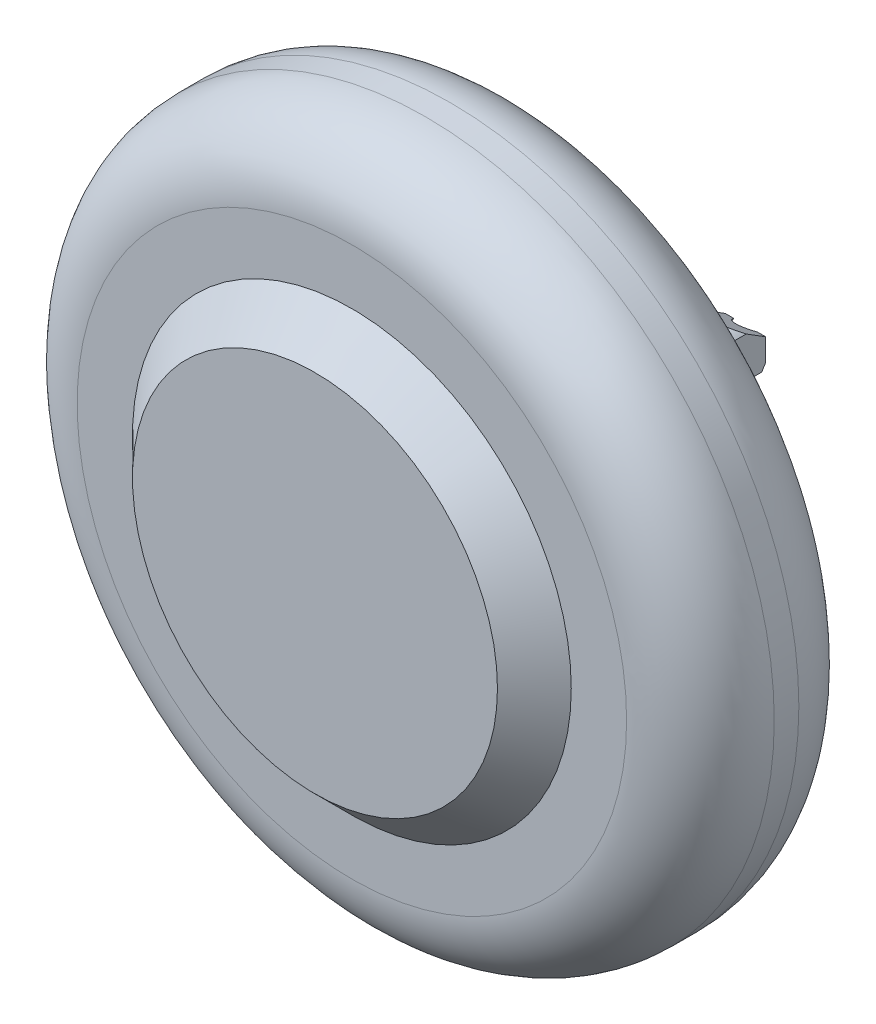
from build123d import *

# Parameters (mm, degrees)
SKETCH_1_R           = 85
EXTRUDE_1_DEPTH      = 21
SKETCH_2_R           = 54.5
EXTRUDE_2_DEPTH      = 30
CHAMFER_1_SIZE       = 10
SKETCH_3_R           = 7
EXTRUDE_3_DEPTH      = 45
SKETCH_5_OUTSIDE_W   = 224.47
SKETCH_5_OUTSIDE_H   = 224.47
SKETCH_5_OUTSIDE_W_2 = 9.85
SKETCH_5_OUTSIDE_H_2 = 14
CUT_EXTRUDE_1_DEPTH  = 40
CHAMFER_3_SIZE       = 1
SKETCH_7_R           = 3.5
CUT_EXTRUDE_2_DEPTH  = 45
FILLET_1_R           = 18
CUT_EXTRUDE_3_REACH  = 146.695


with BuildPart() as part:
    # 草图1 → 凸台-拉伸1 (new, symmetric)
    with BuildSketch(Plane.XY):
        with Locations(Location((0, 0, 0), (0, 0, 180))):
            Circle(SKETCH_1_R)
    extrude(amount=EXTRUDE_1_DEPTH, both=True)

    # 草图2 → 凸台-拉伸2 (add, symmetric)
    with BuildSketch(Plane.XY):
        Circle(SKETCH_2_R)
    extrude(amount=EXTRUDE_2_DEPTH, both=True)

    # 倒角1
    # the kernel refuses this chamfer: 10 mm, written as the material it takes off along each edge
    with BuildSketch(Plane(origin=(0, 0, -30), x_dir=(1, 0, 0), z_dir=(0, -1, 0))) as chamfer_1_piece_1_section:
        Polygon((54.5, CHAMFER_1_SIZE), (54.5 - CHAMFER_1_SIZE, 0), (54.5, 0), align=None)
    chamfer_1_piece_1 = revolve(axis=Axis((0, 0, -30), (0, 0, 1)), mode=Mode.PRIVATE)
    chamfer_1_piece_1 = split(chamfer_1_piece_1, bisect_by=Plane(origin=(-49.041649133, 0, -21), z_dir=(0, 0, -1)), keep=Keep.TOP, mode=Mode.PRIVATE)
    add(chamfer_1_piece_1, mode=Mode.SUBTRACT)
    with BuildSketch(Plane(origin=(0, 0, 30), x_dir=(1, 0, 0), z_dir=(0, -1, 0))) as chamfer_1_piece_2_section:
        Polygon((54.5, -CHAMFER_1_SIZE), (54.5 - CHAMFER_1_SIZE, 0), (54.5, 0), align=None)
    chamfer_1_piece_2 = revolve(axis=Axis((0, 0, 30), (0, 0, 1)), mode=Mode.PRIVATE)
    chamfer_1_piece_2 = split(chamfer_1_piece_2, bisect_by=Plane(origin=(-49.041649133, 0, 21), z_dir=(0, 0, 1)), keep=Keep.TOP, mode=Mode.PRIVATE)
    add(chamfer_1_piece_2, mode=Mode.SUBTRACT)

    # 草图3 → 凸台-拉伸3 (add)
    with BuildSketch(Plane(origin=(0, 0, -30), x_dir=(-1, 0, 0), z_dir=(0, 0, -1))):
        with Locations(Location((0, 0, 0), (0, 0, 180))):
            Circle(SKETCH_3_R)
    extrude(amount=EXTRUDE_3_DEPTH)

    # 草图5 outside → 切除-拉伸1 (cut)
    with BuildSketch(Plane(origin=(0, 0, -75), x_dir=(-1, 0, 0), z_dir=(0, 0, -1))):
        Rectangle(SKETCH_5_OUTSIDE_W, SKETCH_5_OUTSIDE_H)
        Rectangle(SKETCH_5_OUTSIDE_W_2, SKETCH_5_OUTSIDE_H_2, mode=Mode.SUBTRACT)
    extrude(amount=-CUT_EXTRUDE_1_DEPTH, mode=Mode.SUBTRACT)

    # 倒角3
    # the kernel refuses this chamfer: 1 mm, written as the material it takes off along each edge
    with BuildSketch(Plane(origin=(0, 0, -75), x_dir=(-0.9118755958915212, 0.4104666827130834, 0), z_dir=(-0.4104666827130834, -0.9118755958915212, 0))) as chamfer_3_piece_1:
        Polygon((7, -CHAMFER_3_SIZE), (7 - CHAMFER_3_SIZE, 0), (7, 0), align=None)
    revolve(axis=Axis((0, 0, -75), (0, 0, -1)), revolution_arc=65.76584555, mode=Mode.SUBTRACT)
    with BuildSketch(Plane(origin=(0, 0, -75), x_dir=(0.9118755958915, -0.41046668271313064, 0), z_dir=(0.41046668271313064, 0.9118755958915, 0))) as chamfer_3_piece_2:
        Polygon((7, -CHAMFER_3_SIZE), (7 - CHAMFER_3_SIZE, 0), (7, 0), align=None)
    revolve(axis=Axis((0, 0, -75), (0, 0, -1)), revolution_arc=65.76584555, mode=Mode.SUBTRACT)
    with BuildSketch(Plane(origin=(0, 0, -75), x_dir=(0, -1, 0), z_dir=(1, 0, 0))) as chamfer_3_piece_3:
        Polygon((7, -CHAMFER_3_SIZE), (7 - CHAMFER_3_SIZE, 0), (7, 0), align=None)
    revolve(axis=Axis((0, 0, -75), (0, 0, -1)), revolution_arc=65.76584555, mode=Mode.SUBTRACT)
    with BuildSketch(Plane(origin=(0, 0, -75), x_dir=(0, 1, 0), z_dir=(-1, 0, 0))) as chamfer_3_piece_4:
        Polygon((7, -CHAMFER_3_SIZE), (7 - CHAMFER_3_SIZE, 0), (7, 0), align=None)
    revolve(axis=Axis((0, 0, -75), (0, 0, -1)), revolution_arc=65.76584555, mode=Mode.SUBTRACT)

    # 草图7 → 切除-拉伸2 (cut)
    with BuildSketch(Plane(origin=(0, 0, -75), x_dir=(-1, 0, 0), z_dir=(0, 0, -1))):
        Circle(SKETCH_7_R)
    extrude(amount=-CUT_EXTRUDE_2_DEPTH, mode=Mode.SUBTRACT)

    # 圆角1
    fillet_1_edges = [part.edges().sort_by_distance(p)[0] for p in [
        (85, 0, -21),
        (85, 0, 21),
    ]]
    fillet(fillet_1_edges, radius=FILLET_1_R)

    # 草图8 → 切除-拉伸3 (cut, up to next)
    with BuildSketch(Plane(origin=(4.925, 0, 0), x_dir=(0, 0, -1), z_dir=(1, 0, 0)), mode=Mode.PRIVATE) as cut_extrude_3_sk1:
        Polygon((75, 2), (75, 7), (67, 7), align=None)
    cut_extrude_3_tool1 = extrude(cut_extrude_3_sk1.sketch, amount=-CUT_EXTRUDE_3_REACH, mode=Mode.PRIVATE) & part.part
    add(cut_extrude_3_tool1.solids().sort_by_distance((4.925, 5.333333, -72.333333))[0], mode=Mode.SUBTRACT)


solid = part.part
